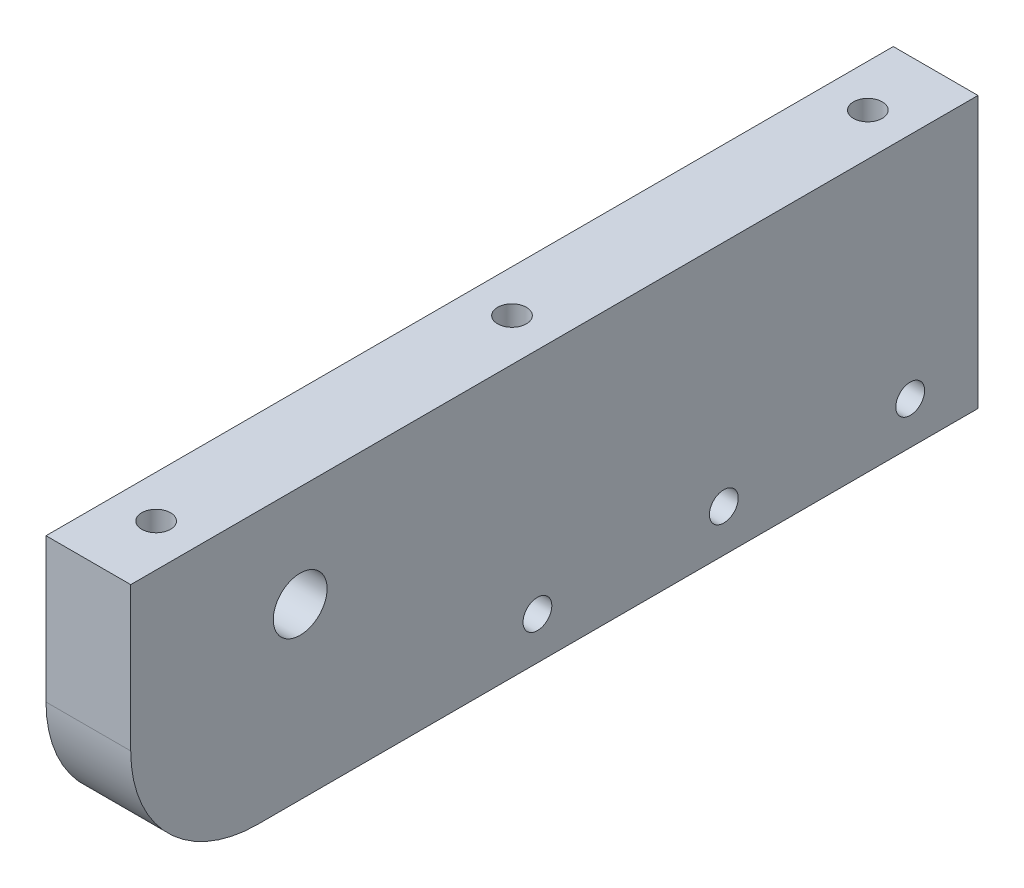
from build123d import *

# Parameters (mm, degrees)
SKETCH1_W                      = 100
SKETCH1_H                      = 32
SKETCH1_R                      = 3.175
BOSS_EXTRUDE1_DEPTH            = 10
FILLET1_R                      = 15
CBORE_FOR_M3_SHCS_D            = 3.4
CBORE_FOR_M3_SHCS_DEPTH        = 23
CBORE_FOR_M3_SHCS_CBORE_D      = 6.5
CBORE_FOR_M3_SHCS_CBORE_DEPTH  = 3
CBORE_FOR_M3_SHCS_TIP          = 1.021463052
CBORE_FOR_M3_SHCS1_D           = 3.4
CBORE_FOR_M3_SHCS1_DEPTH       = 23
CBORE_FOR_M3_SHCS1_CBORE_D     = 6.5
CBORE_FOR_M3_SHCS1_CBORE_DEPTH = 3
CBORE_FOR_M3_SHCS1_TIP         = 1.021463052


with BuildPart() as part:
    # Sketch1 → Boss-Extrude1 (new body)
    with BuildSketch(Plane(origin=(0, 0, 0), x_dir=(0, 0, -1), z_dir=(1, 0, 0))):
        Rectangle(SKETCH1_W, SKETCH1_H)
        with Locations((-30, 4)):
            Circle(SKETCH1_R, mode=Mode.SUBTRACT)
    extrude(amount=BOSS_EXTRUDE1_DEPTH)

    # Fillet1
    fillet1_edges = [part.edges().sort_by_distance(p)[0] for p in [
        (5, -16, 50),
    ]]
    fillet(fillet1_edges, radius=FILLET1_R)

    # CBORE for M3 SHCS
    with Locations(Plane(origin=(-616.293536786, 26, -1323.282701689), x_dir=(1, 0, 0), z_dir=(0, 1, 0))):
        with Locations((731.293536786, -1281.282701689), (731.293536786, -1343.282701689), (621.293536786, -1281.282701689), (621.293536786, -1365.282701689), (621.293536786, -1323.282701689), (731.293536786, -1312.282701689)):
            CounterBoreHole(CBORE_FOR_M3_SHCS_D / 2, CBORE_FOR_M3_SHCS_CBORE_D / 2, CBORE_FOR_M3_SHCS_CBORE_DEPTH, depth=CBORE_FOR_M3_SHCS_DEPTH)
            with Locations((0, 0, -(CBORE_FOR_M3_SHCS_DEPTH + CBORE_FOR_M3_SHCS_TIP / 2))):  # 118° drill point
                Cone(0, CBORE_FOR_M3_SHCS_D / 2, CBORE_FOR_M3_SHCS_TIP, mode=Mode.SUBTRACT)

    # CBORE for M3 SHCS1
    with Locations(Plane(origin=(0, -904.012147263, -1323.282701689), x_dir=(0, 0, 1), z_dir=(-1, 0, 0))):
        with Locations((1281.282701689, 893.012147263), (1325.282701689, 893.012147263), (1303.282701689, 893.012147263)):
            CounterBoreHole(CBORE_FOR_M3_SHCS1_D / 2, CBORE_FOR_M3_SHCS1_CBORE_D / 2, CBORE_FOR_M3_SHCS1_CBORE_DEPTH, depth=CBORE_FOR_M3_SHCS1_DEPTH)
            with Locations((0, 0, -(CBORE_FOR_M3_SHCS1_DEPTH + CBORE_FOR_M3_SHCS1_TIP / 2))):  # 118° drill point
                Cone(0, CBORE_FOR_M3_SHCS1_D / 2, CBORE_FOR_M3_SHCS1_TIP, mode=Mode.SUBTRACT)


solid = part.part
